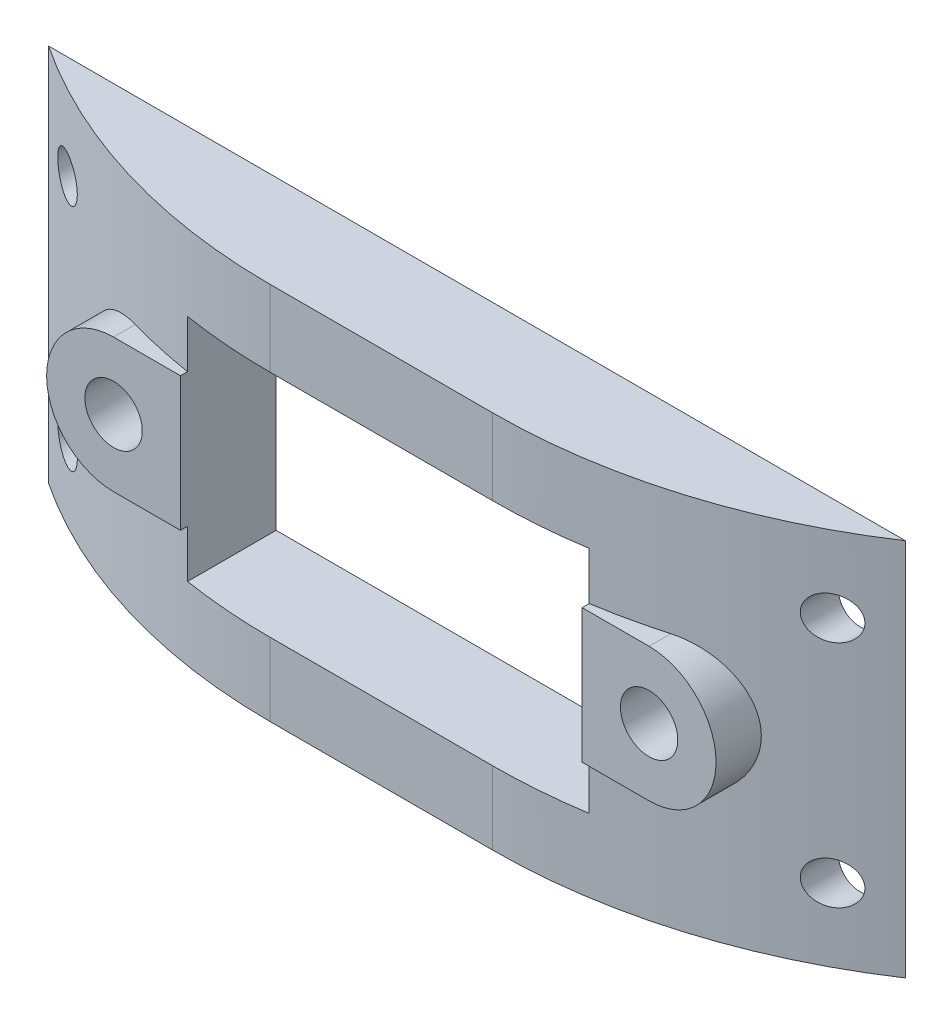
from build123d import *

# Parameters (mm, degrees)
SKETCH1_W           = 44.8
SKETCH1_H           = 19.8
BOSS_EXTRUDE1_DEPTH = 5
SKETCH2_R           = 1.1
CUT_EXTRUDE1_DEPTH  = 13
SKETCH3_R           = 1.5
CUT_EXTRUDE2_DEPTH  = 10
SKETCH4_W           = 21
SKETCH4_H           = 12
CUT_EXTRUDE3_DEPTH  = 10
FILLET1_START       = 9.18
FILLET1_DEPTH       = 19.8
BOSS_EXTRUDE2_START = -5
SKETCH5_R           = 3.5
SKETCH5_R_2         = 1.5
BOSS_EXTRUDE2_DEPTH = 5


with BuildPart() as part:
    # Sketch1 → Boss-Extrude1 (new body)
    with BuildSketch(Plane.XY):
        with Locations((0, 19.08)):
            Rectangle(SKETCH1_W, SKETCH1_H)
    extrude(amount=BOSS_EXTRUDE1_DEPTH)

    # Sketch2 → Cut-Extrude1 (cut)
    with BuildSketch(Plane.XY.offset(5)):
        with Locations((-20, 25)):
            Circle(SKETCH2_R)
        with Locations((-20, 13)):
            Circle(SKETCH2_R)
        with Locations((20, 25)):
            Circle(SKETCH2_R)
        with Locations((20, 13)):
            Circle(SKETCH2_R)
    extrude(amount=-CUT_EXTRUDE1_DEPTH, mode=Mode.SUBTRACT)

    # Sketch3 → Cut-Extrude2 (cut)
    with BuildSketch(Plane.XY.offset(5)):
        with Locations((-14, 19)):
            Circle(SKETCH3_R)
        with Locations((14, 19)):
            Circle(SKETCH3_R)
    extrude(amount=-CUT_EXTRUDE2_DEPTH, mode=Mode.SUBTRACT)

    # Sketch4 → Cut-Extrude3 (cut)
    with BuildSketch(Plane.XY.offset(5)):
        with Locations((0, 19)):
            Rectangle(SKETCH4_W, SKETCH4_H)
    extrude(amount=-CUT_EXTRUDE3_DEPTH, mode=Mode.SUBTRACT)

    # Fillet1: read off the stored shape, not the designer's step
    # Fillet1 outline → Fillet1 (cut)
    with BuildSketch(Plane(origin=(0, 0, 0), x_dir=(1, 0, 0), z_dir=(0, 1, 0)).offset(FILLET1_START)):
        with BuildLine():
            Line((22.4, -5), (22.4, 0))
            ThreePointArc((22.4, 0), (14.477130086, -3.722813233), (5.816876048, -5))
            Line((5.816876048, -5), (22.4, -5))
        make_face()
        with BuildLine():
            Line((-22.4, -5), (-5.816876048, -5))
            ThreePointArc((-5.816876048, -5), (-14.477130086, -3.722813233), (-22.4, 0))
            Line((-22.4, 0), (-22.4, -5))
        make_face()
    extrude(amount=FILLET1_DEPTH, mode=Mode.SUBTRACT)

    # Sketch5 → Boss-Extrude2 (add)
    # profile 1 of 6: a face of its own
    with BuildSketch(Plane(origin=(0, 0, 0), x_dir=(-1, 0, 0), z_dir=(0, 0, -1)).offset(BOSS_EXTRUDE2_START)):
        with Locations((-14, 19)):
            Circle(SKETCH5_R)
        with Locations((-14, 19)):
            Circle(SKETCH5_R_2, mode=Mode.SUBTRACT)
    # profile 2 of 6: a face of its own
    with BuildSketch(Plane(origin=(0, 0, 0), x_dir=(-1, 0, 0), z_dir=(0, 0, -1)).offset(BOSS_EXTRUDE2_START)):
        with BuildLine():
            Line((-10.5, 22.5), (-14, 22.5))
            ThreePointArc((-14, 22.5), (-11.525126266, 21.474873734), (-10.5, 19))
            Line((-10.5, 19), (-10.5, 22.5))
        make_face()
    # profile 3 of 6: a face of its own
    with BuildSketch(Plane(origin=(0, 0, 0), x_dir=(-1, 0, 0), z_dir=(0, 0, -1)).offset(BOSS_EXTRUDE2_START)):
        with BuildLine():
            Line((-10.5, 15.5), (-10.5, 19))
            ThreePointArc((-10.5, 19), (-11.525126266, 16.525126266), (-14, 15.5))
            Line((-14, 15.5), (-10.5, 15.5))
        make_face()
    # profile 4 of 6: a face of its own
    with BuildSketch(Plane(origin=(0, 0, 0), x_dir=(-1, 0, 0), z_dir=(0, 0, -1)).offset(BOSS_EXTRUDE2_START)):
        with Locations((14, 19)):
            Circle(SKETCH5_R)
        with Locations((14, 19)):
            Circle(SKETCH5_R_2, mode=Mode.SUBTRACT)
    # profile 5 of 6: a face of its own
    with BuildSketch(Plane(origin=(0, 0, 0), x_dir=(-1, 0, 0), z_dir=(0, 0, -1)).offset(BOSS_EXTRUDE2_START)):
        with BuildLine():
            ThreePointArc((14, 15.5), (11.525126266, 16.525126266), (10.5, 19))
            Line((10.5, 19), (10.5, 15.5))
            Line((10.5, 15.5), (14, 15.5))
        make_face()
    # profile 6 of 6: a face of its own
    with BuildSketch(Plane(origin=(0, 0, 0), x_dir=(-1, 0, 0), z_dir=(0, 0, -1)).offset(BOSS_EXTRUDE2_START)):
        with BuildLine():
            ThreePointArc((10.5, 19), (11.525126266, 21.474873734), (14, 22.5))
            Line((14, 22.5), (10.5, 22.5))
            Line((10.5, 22.5), (10.5, 19))
        make_face()
    extrude(amount=BOSS_EXTRUDE2_DEPTH)


solid = part.part
